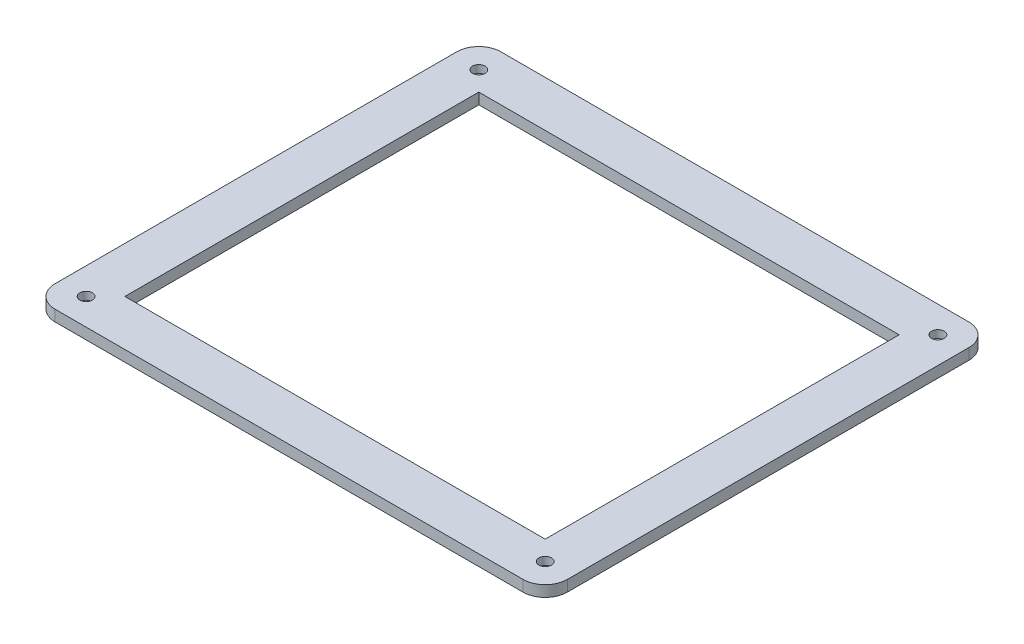
from build123d import *

# Parameters (mm, degrees)
SKETCH1_W               = 231.4
SKETCH1_H               = 201.4
SKETCH1_W_2             = 189.9
SKETCH1_H_2             = 159.9
BOSS_EXTRUDE1_DEPTH     = 5
FILLET1_R               = 10
SKETCH2_R               = 5.85
BOSS_EXTRUDE2_DEPTH     = 2.5
SKETCH3_R               = 1.55
CUT_EXTRUDE1_DEPTH      = 7.5
SKETCH4_R               = 2.85
CUT_EXTRUDE2_DEPTH      = 3.5
MIRROR4_COPY_1_SKETCH_R = 5.85
MIRROR4_COPY_1_DEPTH    = 2.5
MIRROR4_COPY_2_SKETCH_R = 1.55
MIRROR4_COPY_2_DEPTH    = 7.5
MIRROR4_COPY_3_SKETCH_R = 2.85
MIRROR4_COPY_3_DEPTH    = 3.5
MIRROR4_COPY_4_SKETCH_R = 5.85
MIRROR4_COPY_4_DEPTH    = 2.5
MIRROR4_COPY_5_SKETCH_R = 1.55
MIRROR4_COPY_5_DEPTH    = 7.5
MIRROR4_COPY_6_SKETCH_R = 2.85
MIRROR4_COPY_6_DEPTH    = 3.5


with BuildPart() as part:
    # Sketch1 → Boss-Extrude1 (new body)
    with BuildSketch(Plane(origin=(0, 0, 0), x_dir=(1, 0, 0), z_dir=(0, 1, 0))):
        Rectangle(SKETCH1_W, SKETCH1_H)
        Rectangle(SKETCH1_W_2, SKETCH1_H_2, mode=Mode.SUBTRACT)
    extrude(amount=BOSS_EXTRUDE1_DEPTH)

    # Fillet1
    fillet1_edges = [part.edges().sort_by_distance(p)[0] for p in [
        (-115.7, 2.5, -100.7),
        (115.7, 2.5, -100.7),
        (115.7, 2.5, 100.7),
        (-115.7, 2.5, 100.7),
    ]]
    fillet(fillet1_edges, radius=FILLET1_R)

    # Sketch2 → Boss-Extrude2 (add)
    with BuildSketch(Plane.XZ):
        with Locations((-103.7, 88.7)):
            Circle(SKETCH2_R)
    boss_extrude2 = extrude(amount=BOSS_EXTRUDE2_DEPTH)

    # Sketch3 → Cut-Extrude1 (cut)
    with BuildSketch(Plane(origin=(0, 5, 0), x_dir=(1, 0, 0), z_dir=(0, 1, 0))):
        with Locations((-103.7, -88.7)):
            Circle(SKETCH3_R)
    cut_extrude1 = extrude(amount=-CUT_EXTRUDE1_DEPTH, mode=Mode.SUBTRACT)

    # Sketch4 → Cut-Extrude2 (cut)
    with BuildSketch(Plane(origin=(0, 5, 0), x_dir=(1, 0, 0), z_dir=(0, 1, 0))):
        with Locations((-103.7, -88.7)):
            Circle(SKETCH4_R)
    cut_extrude2 = extrude(amount=-CUT_EXTRUDE2_DEPTH, mode=Mode.SUBTRACT)

    # Mirror3: Boss-Extrude2, Cut-Extrude1, Cut-Extrude2 across plane
    add(boss_extrude2.mirror(Plane(origin=(0, 0, 0), x_dir=(0, 0, 1), z_dir=(1, 0, 0))))
    add(cut_extrude1.mirror(Plane(origin=(0, 0, 0), x_dir=(0, 0, 1), z_dir=(1, 0, 0))), mode=Mode.SUBTRACT)
    add(cut_extrude2.mirror(Plane(origin=(0, 0, 0), x_dir=(0, 0, 1), z_dir=(1, 0, 0))), mode=Mode.SUBTRACT)

    # Mirror4 copy 1 sketch → Mirror4 copy 1 (add)
    with BuildSketch(Plane(origin=(0, 0, 0), x_dir=(-1, 0, 0), z_dir=(0, -1, 0))):
        with Locations((-103.7, 88.7)):
            Circle(MIRROR4_COPY_1_SKETCH_R)
    extrude(amount=MIRROR4_COPY_1_DEPTH)

    # Mirror4 copy 2 sketch → Mirror4 copy 2 (cut)
    with BuildSketch(Plane(origin=(0, 5, 0), x_dir=(-1, 0, 0), z_dir=(0, 1, 0))):
        with Locations((-103.7, -88.7)):
            Circle(MIRROR4_COPY_2_SKETCH_R)
    extrude(amount=-MIRROR4_COPY_2_DEPTH, mode=Mode.SUBTRACT)

    # Mirror4 copy 3 sketch → Mirror4 copy 3 (cut)
    with BuildSketch(Plane(origin=(0, 5, 0), x_dir=(-1, 0, 0), z_dir=(0, 1, 0))):
        with Locations((-103.7, -88.7)):
            Circle(MIRROR4_COPY_3_SKETCH_R)
    extrude(amount=-MIRROR4_COPY_3_DEPTH, mode=Mode.SUBTRACT)

    # Mirror4 copy 4 sketch → Mirror4 copy 4 (add)
    with BuildSketch(Plane.XZ):
        with Locations((-103.7, -88.7)):
            Circle(MIRROR4_COPY_4_SKETCH_R)
    extrude(amount=MIRROR4_COPY_4_DEPTH)

    # Mirror4 copy 5 sketch → Mirror4 copy 5 (cut)
    with BuildSketch(Plane(origin=(0, 5, 0), x_dir=(1, 0, 0), z_dir=(0, 1, 0))):
        with Locations((-103.7, 88.7)):
            Circle(MIRROR4_COPY_5_SKETCH_R)
    extrude(amount=-MIRROR4_COPY_5_DEPTH, mode=Mode.SUBTRACT)

    # Mirror4 copy 6 sketch → Mirror4 copy 6 (cut)
    with BuildSketch(Plane(origin=(0, 5, 0), x_dir=(1, 0, 0), z_dir=(0, 1, 0))):
        with Locations((-103.7, 88.7)):
            Circle(MIRROR4_COPY_6_SKETCH_R)
    extrude(amount=-MIRROR4_COPY_6_DEPTH, mode=Mode.SUBTRACT)


solid = part.part
